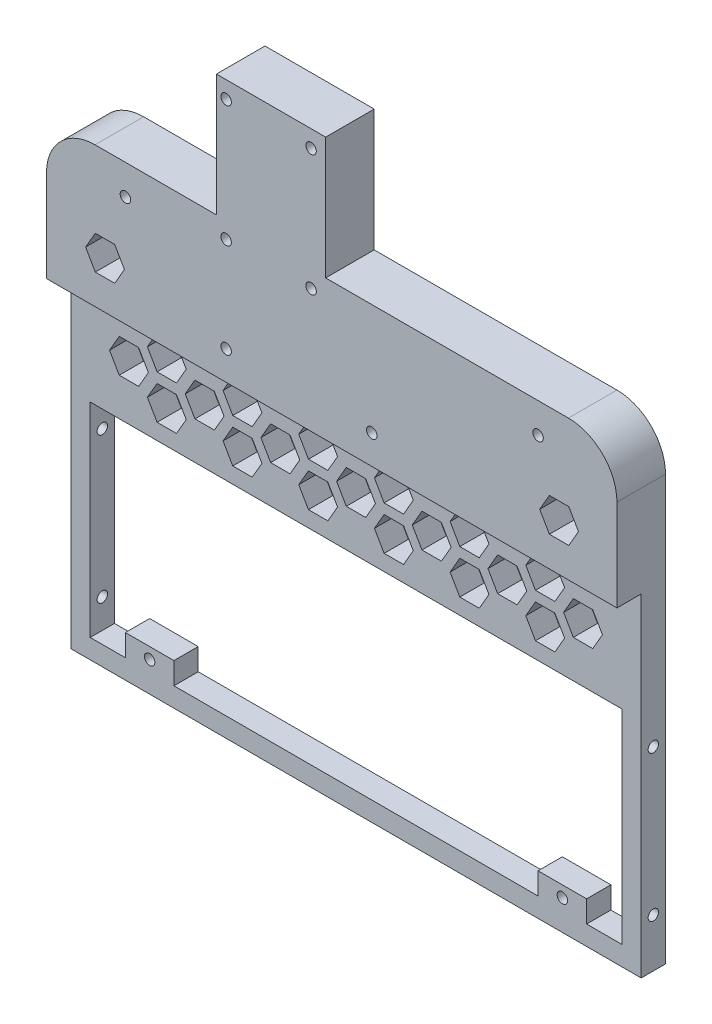
from build123d import *

# Parameters (mm, degrees)
SKETCH1_W                = 235
SKETCH1_H                = 245
BOSS_EXTRUDE1_DEPTH      = 10
SKETCH12_W               = 120
SKETCH12_H               = 50.23697577
SKETCH12_W_2             = 70
CUT_EXTRUDE5_DEPTH       = 171.036760731
FILLET1_R                = 20
SKETCH18_R               = 2.15
CUT_EXTRUDE7_DEPTH       = 266.200395927
CUT_EXTRUDE9_DEPTH       = 10
BOSS_EXTRUDE2_DEPTH      = 10
CUT_EXTRUDE8_DEPTH       = 171.036760731
CUT_EXTRUDE8_DEPTH_BACK  = 171.036760731
SKETCH19_R               = 2.15
CUT_EXTRUDE10_DEPTH      = 171.036760731
CUT_EXTRUDE10_DEPTH_BACK = 171.036760731
SKETCH20_R               = 2.15
FILL_PATTERN1_DEPTH      = 10
FILL_PATTERN2_DEPTH      = 20


# Read off the part's stored shape, not the designer's step: Fill Pattern1, Fill Pattern2
with BuildPart() as part:
    # Sketch1 → Boss-Extrude1 (new body)
    with BuildSketch(Plane.XY):
        Rectangle(SKETCH1_W, SKETCH1_H)
    extrude(amount=BOSS_EXTRUDE1_DEPTH)

    # Sketch12 → Cut-Extrude5 (cut, through all)
    with BuildSketch(Plane.XY.offset(10)):
        with Locations((57.5, 97.381512115)):
            Rectangle(SKETCH12_W, SKETCH12_H)
        with Locations((-82.5, 97.381512115)):
            Rectangle(SKETCH12_W_2, SKETCH12_H)
    extrude(amount=-CUT_EXTRUDE5_DEPTH, mode=Mode.SUBTRACT)

    # Fillet1
    fillet1_edges = [part.edges().sort_by_distance(p)[0] for p in [
        (-117.5, 72.26302423, 5),
        (117.5, 72.26302423, 5),
    ]]
    fillet(fillet1_edges, radius=FILLET1_R)

    # Sketch18 → Cut-Extrude7 (cut, through all)
    with BuildSketch(Plane.ZY.offset(117.5)):
        with Locations(Location((5, -102.5, 0), (0, 0, 270))):
            Circle(SKETCH18_R)
        with Locations(Location((5, -42.5, 0), (0, 0, 270))):
            Circle(SKETCH18_R)
    extrude(amount=-CUT_EXTRUDE7_DEPTH, mode=Mode.SUBTRACT)

    # Sketch6 → Cut-Extrude9 (cut)
    with BuildSketch(Plane.XY.offset(10)):
        Polygon((0, -30.5), (-109.5, -30.5), (-109.5, -114.5), (-95, -114.5), (-95, -105.5), (-75, -105.5), (-75, -114.5), (0, -114.5), align=None)
        Polygon((109.5, -30.5), (0, -30.5), (0, -114.5), (75, -114.5), (75, -105.5), (95, -105.5), (95, -114.5), (109.5, -114.5), align=None)
    extrude(amount=-CUT_EXTRUDE9_DEPTH, mode=Mode.SUBTRACT)

    # Sketch21 → Boss-Extrude2 (add)
    with BuildSketch(Plane.XY.offset(10)):
        with BuildLine():
            Line((-117.5, 14.520938675), (117.5, 14.520938675))
            Line((117.5, 14.520938675), (117.5, 52.26302423))
            ThreePointArc((117.5, 52.26302423), (111.642135624, 66.405159853), (97.5, 72.26302423))
            Line((97.5, 72.26302423), (-2.5, 72.26302423))
            Line((-2.5, 72.26302423), (-2.5, 122.5))
            Line((-2.5, 122.5), (-47.5, 122.5))
            Line((-47.5, 122.5), (-47.5, 72.26302423))
            Line((-47.5, 72.26302423), (-97.5, 72.26302423))
            ThreePointArc((-97.5, 72.26302423), (-111.642135624, 66.405159853), (-117.5, 52.26302423))
            Line((-117.5, 52.26302423), (-117.5, 14.520938675))
        make_face()
    extrude(amount=BOSS_EXTRUDE2_DEPTH)

    # Sketch19 → Cut-Extrude8 (cut, two sides: drawn at the far end of the back side and taken through both)
    with BuildSketch(Plane.XY.offset(10).offset(-CUT_EXTRUDE8_DEPTH_BACK)):
        with Locations((-43.5, 65.5)):
            Circle(SKETCH19_R)
        with Locations((-8.5, 65.5)):
            Circle(SKETCH19_R)
        with Locations((-43.5, 115.5)):
            Circle(SKETCH19_R)
        with Locations((-8.5, 115.5)):
            Circle(SKETCH19_R)
        with Locations((-43.5, 26.5)):
            Circle(SKETCH19_R)
        with Locations((16.5, 26.5)):
            Circle(SKETCH19_R)
    extrude(amount=CUT_EXTRUDE8_DEPTH + CUT_EXTRUDE8_DEPTH_BACK, mode=Mode.SUBTRACT)

    # Sketch20 → Cut-Extrude10 (cut, two sides: drawn at the far end of the back side and taken through both)
    with BuildSketch(Plane.XY.offset(10).offset(-CUT_EXTRUDE10_DEPTH_BACK)):
        with Locations((-85, 59.881512115)):
            Circle(SKETCH20_R)
        with Locations((85, 59.881512115)):
            Circle(SKETCH20_R)
        with Locations((85, -110.118487885)):
            Circle(SKETCH20_R)
        with Locations((-85, -110.118487885)):
            Circle(SKETCH20_R)
    extrude(amount=CUT_EXTRUDE10_DEPTH + CUT_EXTRUDE10_DEPTH_BACK, mode=Mode.SUBTRACT)

    # Fill Pattern1 outline → Fill Pattern1 (cut)
    with BuildSketch(Plane.XY):
        Polygon((85.942286341, -17.029224914), (81.942286341, -10.101021684), (73.942286341, -10.101021684), (69.942286341, -17.029224914), (73.942286341, -23.957428145), (81.942286341, -23.957428145), align=None)
        Polygon((-73.942286341, -10.101021684), (-81.942286341, -10.101021684), (-85.942286341, -17.029224914), (-81.942286341, -23.957428145), (-73.942286341, -23.957428145), (-69.942286341, -17.029224914), align=None)
        Polygon((-42.765371804, -10.101021684), (-50.765371804, -10.101021684), (-54.765371804, -17.029224914), (-50.765371804, -23.957428145), (-42.765371804, -23.957428145), (-38.765371804, -17.029224914), align=None)
        Polygon((-11.588457268, -10.101021684), (-19.588457268, -10.101021684), (-23.588457268, -17.029224914), (-19.588457268, -23.957428145), (-11.588457268, -23.957428145), (-7.588457268, -17.029224914), align=None)
        Polygon((19.588457268, -10.101021684), (11.588457268, -10.101021684), (7.588457268, -17.029224914), (11.588457268, -23.957428145), (19.588457268, -23.957428145), (23.588457268, -17.029224914), align=None)
        Polygon((50.765371804, -10.101021684), (42.765371804, -10.101021684), (38.765371804, -17.029224914), (42.765371804, -23.957428145), (50.765371804, -23.957428145), (54.765371804, -17.029224914), align=None)
        Polygon((-38.765371804, 0.970775086), (-42.765371804, 7.898978316), (-50.765371804, 7.898978316), (-54.765371804, 0.970775086), (-50.765371804, -5.957428145), (-42.765371804, -5.957428145), align=None)
        Polygon((-11.588457268, 7.898978316), (-19.588457268, 7.898978316), (-23.588457268, 0.970775086), (-19.588457268, -5.957428145), (-11.588457268, -5.957428145), (-7.588457268, 0.970775086), align=None)
        Polygon((-73.942286341, 7.898978316), (-81.942286341, 7.898978316), (-85.942286341, 0.970775086), (-81.942286341, -5.957428145), (-73.942286341, -5.957428145), (-69.942286341, 0.970775086), align=None)
        Polygon((81.942286341, 7.898978316), (73.942286341, 7.898978316), (69.942286341, 0.970775086), (73.942286341, -5.957428145), (81.942286341, -5.957428145), (85.942286341, 0.970775086), align=None)
        Polygon((50.765371804, 7.898978316), (42.765371804, 7.898978316), (38.765371804, 0.970775086), (42.765371804, -5.957428145), (50.765371804, -5.957428145), (54.765371804, 0.970775086), align=None)
        Polygon((19.588457268, 7.898978316), (11.588457268, 7.898978316), (7.588457268, 0.970775086), (11.588457268, -5.957428145), (19.588457268, -5.957428145), (23.588457268, 0.970775086), align=None)
        Polygon((70.353829072, -8.029224914), (66.353829072, -1.101021684), (58.353829072, -1.101021684), (54.353829072, -8.029224914), (58.353829072, -14.957428145), (66.353829072, -14.957428145), align=None)
        Polygon((97.530743609, -1.101021684), (89.530743609, -1.101021684), (85.530743609, -8.029224914), (89.530743609, -14.957428145), (97.530743609, -14.957428145), (101.530743609, -8.029224914), align=None)
        Polygon((-89.530743609, -1.101021684), (-97.530743609, -1.101021684), (-101.530743609, -8.029224914), (-97.530743609, -14.957428145), (-89.530743609, -14.957428145), (-85.530743609, -8.029224914), align=None)
        Polygon((-58.353829072, -1.101021684), (-66.353829072, -1.101021684), (-70.353829072, -8.029224914), (-66.353829072, -14.957428145), (-58.353829072, -14.957428145), (-54.353829072, -8.029224914), align=None)
        Polygon((-27.176914536, -1.101021684), (-35.176914536, -1.101021684), (-39.176914536, -8.029224914), (-35.176914536, -14.957428145), (-27.176914536, -14.957428145), (-23.176914536, -8.029224914), align=None)
        Polygon((4, -1.101021684), (-4, -1.101021684), (-8, -8.029224914), (-4, -14.957428145), (4, -14.957428145), (8, -8.029224914), align=None)
        Polygon((35.176914536, -1.101021684), (27.176914536, -1.101021684), (23.176914536, -8.029224914), (27.176914536, -14.957428145), (35.176914536, -14.957428145), (39.176914536, -8.029224914), align=None)
    extrude(amount=FILL_PATTERN1_DEPTH, mode=Mode.SUBTRACT)

    # Fill Pattern2 outline → Fill Pattern2 (cut)
    with BuildSketch(Plane.XY):
        Polygon((-85.394889566, 33.825245384), (-89.394889566, 40.753448614), (-97.394889566, 40.753448614), (-101.394889566, 33.825245384), (-97.394889566, 26.897042154), (-89.394889566, 26.897042154), align=None)
        Polygon((97.666597652, 40.753448614), (89.666597652, 40.753448614), (85.666597652, 33.825245384), (89.666597652, 26.897042154), (97.666597652, 26.897042154), (101.666597652, 33.825245384), align=None)
    extrude(amount=FILL_PATTERN2_DEPTH, mode=Mode.SUBTRACT)


solid = part.part
